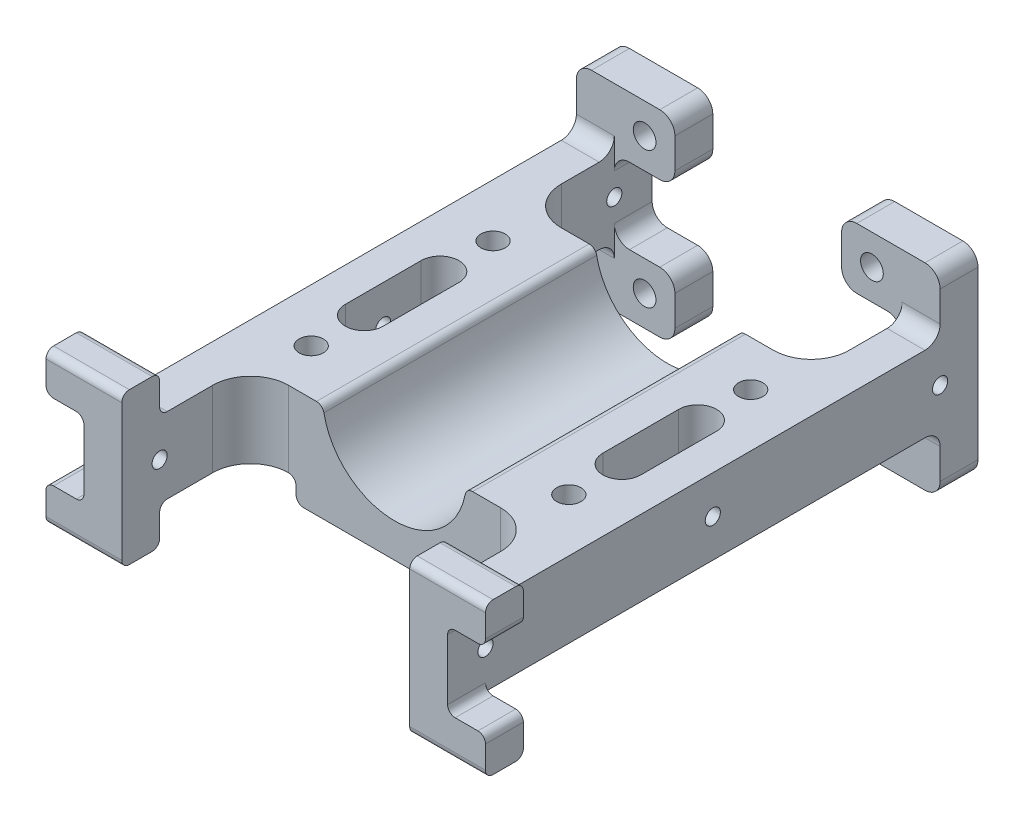
from build123d import *

# Parameters (mm, degrees)
EXTRUDE_1_DEPTH          = 50
CUT_EXTRUDE_1_DEPTH      = 65.195015383
CUT_EXTRUDE_1_DEPTH_BACK = 65.195015383
SKETCH_2_R               = 1.6
SKETCH_2_R_2             = 1.1
CUT_EXTRUDE_4_DEPTH      = 64.914004725
CUT_EXTRUDE_4_DEPTH_BACK = 64.914004725
SKETCH_8_W               = 61
SKETCH_8_H               = 50
SKETCH_8_W_2             = 38
SKETCH_8_H_2             = 36
SKETCH_8_W_3             = 17
SKETCH_8_R               = 1.1
SKETCH_9_W               = 70
SKETCH_9_H               = 10
EXTRUDE_2_DEPTH          = 5
SKETCH_10_R              = 1
CUT_EXTRUDE_5_DEPTH      = 5
SKETCH_11_W              = 5
SKETCH_11_H              = 5
EXTRUDE_3_DEPTH          = 5
FILLET_7_R               = 1
FILLET_8_R               = 1
FILLET_10_R              = 5
MIRROR_START             = 19
MIRROR_1_OUTLINE_R       = 1
MIRROR_1_DEPTH           = 5
MIRROR_START_2           = 24
MIRROR_1_2_OUTLINE_W     = 5
MIRROR_1_2_OUTLINE_H     = 5
MIRROR_1_2_DEPTH         = 4
MIRROR_START_3           = 25
MIRROR_1_3_OUTLINE_W     = 5
MIRROR_1_3_OUTLINE_H     = 5
MIRROR_1_3_DEPTH         = 4
MIRROR_START_4           = 55
MIRROR_1_4_DEPTH         = 5
MIRROR_START_5           = -11
MIRROR_1_5_DEPTH         = 10
MIRROR_START_6           = 28
MIRROR_1_6_DEPTH         = 2
CUT_EXTRUDE_7_DEPTH      = 15
SKETCH_15_R              = 1.5
EXTRUDE_4_DEPTH          = 5
FILLET_11_R              = 2
FILLET_12_R              = 2
SKETCH_16_W              = 8.633126958
SKETCH_16_H              = 25.605085421
SKETCH_16_W_2            = 10.767561134
SKETCH_16_H_2            = 22.237422609
CUT_EXTRUDE_8_DEPTH      = 5


with BuildPart() as part:
    # 草图1 → 凸台-拉伸1 (new body)
    with BuildSketch(Plane.XY):
        with BuildLine():
            Line((-39, -1), (-10.307764064, -1))
            ThreePointArc((-10.307764064, -1), (-9.671555054, -1.22848325), (-9.326072248, -1.80952381))
            ThreePointArc((-9.326072248, -1.80952381), (0, -9.5), (9.326072248, -1.80952381))
            ThreePointArc((9.326072248, -1.80952381), (9.671555054, -1.22848325), (10.307764064, -1))
            Line((10.307764064, -1), (39, -1))
            Line((39, -1), (39, -6))
            Line((39, -6), (22, -6))
            ThreePointArc((22, -6), (21.292893219, -6.292893219), (21, -7))
            Line((21, -7), (21, -11))
            Line((21, -11), (14, -11))
            ThreePointArc((14, -11), (13.292893219, -11.292893219), (13, -12))
            Line((13, -12), (13, -13))
            ThreePointArc((13, -13), (12.707106781, -13.707106781), (12, -14))
            Line((12, -14), (-12, -14))
            ThreePointArc((-12, -14), (-12.707106781, -13.707106781), (-13, -13))
            Line((-13, -13), (-13, -12))
            ThreePointArc((-13, -12), (-13.292893219, -11.292893219), (-14, -11))
            Line((-14, -11), (-21, -11))
            Line((-21, -11), (-21, -7))
            ThreePointArc((-21, -7), (-21.292893219, -6.292893219), (-22, -6))
            Line((-22, -6), (-39, -6))
            Line((-39, -6), (-39, -1))
        make_face()
    extrude(amount=EXTRUDE_1_DEPTH)

    # 草图2 → 切除-拉伸1 (cut, two sides: drawn at the far end of the back side and taken through both)
    with BuildSketch(Plane.XZ.offset(11).offset(-CUT_EXTRUDE_1_DEPTH_BACK)):
        with Locations(Location((-17, 37, 0), (0, 0, 270))):
            Circle(SKETCH_2_R)
        with Locations(Location((17, 37, 0), (0, 0, 270))):
            Circle(SKETCH_2_R)
        with Locations(Location((17, 13, 0), (0, 0, 270))):
            Circle(SKETCH_2_R)
        with Locations(Location((-17, 13, 0), (0, 0, 270))):
            Circle(SKETCH_2_R)
        with Locations(Location((-36, 43, 0), (0, 0, 270))):
            Circle(SKETCH_2_R_2)
        with Locations(Location((-24, 43, 0), (0, 0, 270))):
            Circle(SKETCH_2_R_2)
        with Locations(Location((-24, 35, 0), (0, 0, 270))):
            Circle(SKETCH_2_R_2)
        with Locations(Location((-36, 35, 0), (0, 0, 270))):
            Circle(SKETCH_2_R_2)
        with Locations(Location((36, 35, 0), (0, 0, 180))):
            Circle(SKETCH_2_R_2)
        with Locations(Location((24, 35, 0), (0, 0, 180))):
            Circle(SKETCH_2_R_2)
        with Locations(Location((24, 43, 0), (0, 0, 180))):
            Circle(SKETCH_2_R_2)
        with Locations(Location((36, 43, 0), (0, 0, 180))):
            Circle(SKETCH_2_R_2)
        with Locations(Location((36, 7, 0), (0, 0, 270))):
            Circle(SKETCH_2_R_2)
        with Locations(Location((24, 7, 0), (0, 0, 270))):
            Circle(SKETCH_2_R_2)
        with Locations(Location((24, 15, 0), (0, 0, 270))):
            Circle(SKETCH_2_R_2)
        with Locations(Location((36, 15, 0), (0, 0, 270))):
            Circle(SKETCH_2_R_2)
        with Locations(Location((-36, 15, 0), (0, 0, 180))):
            Circle(SKETCH_2_R_2)
        with Locations(Location((-24, 15, 0), (0, 0, 180))):
            Circle(SKETCH_2_R_2)
        with Locations(Location((-24, 7, 0), (0, 0, 180))):
            Circle(SKETCH_2_R_2)
        with Locations(Location((-36, 7, 0), (0, 0, 180))):
            Circle(SKETCH_2_R_2)
    extrude(amount=CUT_EXTRUDE_1_DEPTH + CUT_EXTRUDE_1_DEPTH_BACK, mode=Mode.SUBTRACT)

    # 草图8 → 切除-拉伸4 (cut, two sides: drawn at the far end of the back side and taken through both)
    # profile 1 of 2: a face of its own
    with BuildSketch(Plane.XZ.offset(6).offset(-CUT_EXTRUDE_4_DEPTH_BACK)):
        with Locations((8.5, 25)):
            Rectangle(SKETCH_8_W, SKETCH_8_H)
        with Locations((0, 25)):
            Rectangle(SKETCH_8_W_2, SKETCH_8_H_2, mode=Mode.SUBTRACT)
    # profile 2 of 2: a face of its own
    with BuildSketch(Plane.XZ.offset(6).offset(-CUT_EXTRUDE_4_DEPTH_BACK)):
        with Locations((-30.5, 25)):
            Rectangle(SKETCH_8_W_3, SKETCH_8_H)
        with Locations((-36, 43)):
            Circle(SKETCH_8_R, mode=Mode.SUBTRACT)
        with Locations((-24, 35)):
            Circle(SKETCH_8_R, mode=Mode.SUBTRACT)
        with Locations((-24, 15)):
            Circle(SKETCH_8_R, mode=Mode.SUBTRACT)
        with Locations((-36, 7)):
            Circle(SKETCH_8_R, mode=Mode.SUBTRACT)
        with Locations((-24, 7)):
            Circle(SKETCH_8_R, mode=Mode.SUBTRACT)
        with Locations((-24, 43)):
            Circle(SKETCH_8_R, mode=Mode.SUBTRACT)
        with Locations((-36, 35)):
            Circle(SKETCH_8_R, mode=Mode.SUBTRACT)
        with Locations((-36, 15)):
            Circle(SKETCH_8_R, mode=Mode.SUBTRACT)
    extrude(amount=CUT_EXTRUDE_4_DEPTH + CUT_EXTRUDE_4_DEPTH_BACK, mode=Mode.SUBTRACT)

    # 草图9 → 凸台-拉伸2 (add)
    with BuildSketch(Plane.ZY.offset(19)):
        with Locations((25, -6)):
            Rectangle(SKETCH_9_W, SKETCH_9_H)
    extrude(amount=EXTRUDE_2_DEPTH)

    # 草图10 → 切除-拉伸5 (cut)
    with BuildSketch(Plane.ZY.offset(24)):
        with Locations((-5, -6)):
            Circle(SKETCH_10_R)
        with Locations((25, -6)):
            Circle(SKETCH_10_R)
        with Locations((55, -6)):
            Circle(SKETCH_10_R)
    extrude(amount=-CUT_EXTRUDE_5_DEPTH, mode=Mode.SUBTRACT)

    # 草图11 → 凸台-拉伸3 (add, symmetric)
    with BuildSketch(Plane.ZY.offset(24)):
        with Locations((-7.5, 1.5)):
            Rectangle(SKETCH_11_W, SKETCH_11_H)
        with Locations((-7.5, -13.5)):
            Rectangle(SKETCH_11_W, SKETCH_11_H)
        with Locations((57.5, -13.5)):
            Rectangle(SKETCH_11_W, SKETCH_11_H)
        with Locations((57.5, 1.5)):
            Rectangle(SKETCH_11_W, SKETCH_11_H)
    extrude(amount=EXTRUDE_3_DEPTH, both=True)

    # 圆角7
    fillet_7_edges = [part.edges().sort_by_distance(p)[0] for p in [
        (-21.5, -11, 55),
        (-24, -16, 60),
        (-24, -16, 55),
        (-21.5, -1, 55),
        (-24, 4, 55),
        (-24, 4, 60),
    ]]
    fillet(fillet_7_edges, radius=FILLET_7_R)

    # 圆角8
    fillet_8_edges = [part.edges().sort_by_distance(p)[0] for p in [
        (-24, -1, 57.5),
        (-24, -11, 57.5),
        (-29, -11, 57.5),
        (-29, -1, 57.5),
    ]]
    fillet(fillet_8_edges, radius=FILLET_8_R)

    # 圆角10
    fillet_10_edges = [part.edges().sort_by_distance(p)[0] for p in [
        (-19, -6, 43),
        (-19, -6, 7),
    ]]
    fillet(fillet_10_edges, radius=FILLET_10_R)

    # 镜向1: read off the stored shape, not the designer's step
    # 镜向1 outline → 镜向1 (add)
    with BuildSketch(Plane.YZ.offset(MIRROR_START)):
        with BuildLine():
            Line((-1, 55), (3, 55))
            ThreePointArc((3, 55), (3.707106781, 55.292893219), (4, 56))
            Line((4, 56), (4, 59))
            ThreePointArc((4, 59), (3.707106781, 59.707106781), (3, 60))
            Line((3, 60), (-15, 60))
            ThreePointArc((-15, 60), (-15.707106781, 59.707106781), (-16, 59))
            Line((-16, 59), (-16, 56))
            ThreePointArc((-16, 56), (-15.707106781, 55.292893219), (-15, 55))
            Line((-15, 55), (-11, 55))
            Line((-11, 55), (-11, -5))
            Line((-11, -5), (-16, -5))
            Line((-16, -5), (-16, -10))
            Line((-16, -10), (4, -10))
            Line((4, -10), (4, -5))
            Line((4, -5), (-1, -5))
            Line((-1, -5), (-1, 55))
        make_face()
        with Locations((-6, 55)):
            Circle(MIRROR_1_OUTLINE_R, mode=Mode.SUBTRACT)
        with Locations((-6, 25)):
            Circle(MIRROR_1_OUTLINE_R, mode=Mode.SUBTRACT)
        with Locations((-6, -5)):
            Circle(MIRROR_1_OUTLINE_R, mode=Mode.SUBTRACT)
    extrude(amount=MIRROR_1_DEPTH)

    # Mirror 1 2 outline → Mirror 1 2 (add)
    with BuildSketch(Plane.YZ.offset(MIRROR_START_2)):
        with BuildLine():
            Line((-1, 60), (-1, 55))
            Line((-1, 55), (3, 55))
            ThreePointArc((3, 55), (3.707106781, 55.292893219), (4, 56))
            Line((4, 56), (4, 59))
            ThreePointArc((4, 59), (3.707106781, 59.707106781), (3, 60))
            Line((3, 60), (-1, 60))
        make_face()
        with BuildLine():
            Line((-11, 55), (-11, 60))
            Line((-11, 60), (-15, 60))
            ThreePointArc((-15, 60), (-15.707106781, 59.707106781), (-16, 59))
            Line((-16, 59), (-16, 56))
            ThreePointArc((-16, 56), (-15.707106781, 55.292893219), (-15, 55))
            Line((-15, 55), (-11, 55))
        make_face()
        with Locations((1.5, -7.5)):
            Rectangle(MIRROR_1_2_OUTLINE_W, MIRROR_1_2_OUTLINE_H)
        with Locations((-13.5, -7.5)):
            Rectangle(MIRROR_1_2_OUTLINE_W, MIRROR_1_2_OUTLINE_H)
    extrude(amount=MIRROR_1_2_DEPTH)

    # Mirror 1 3 outline → Mirror 1 3 (add)
    with BuildSketch(Plane.YZ.offset(MIRROR_START_3)):
        with Locations((1.5, -7.5)):
            Rectangle(MIRROR_1_3_OUTLINE_W, MIRROR_1_3_OUTLINE_H)
        with Locations((-13.5, -7.5)):
            Rectangle(MIRROR_1_3_OUTLINE_W, MIRROR_1_3_OUTLINE_H)
    extrude(amount=MIRROR_1_3_DEPTH)

    # Mirror 1 4 outline → Mirror 1 4 (add)
    with BuildSketch(Plane.XY.offset(MIRROR_START_4)):
        with BuildLine():
            Line((28, -16), (29, -16))
            Line((29, -16), (29, -12))
            ThreePointArc((29, -12), (28.707106781, -11.292893219), (28, -11))
            Line((28, -11), (28, -16))
        make_face()
        with BuildLine():
            Line((24, -11), (25, -11))
            ThreePointArc((25, -11), (24.292893219, -10.707106781), (24, -10))
            Line((24, -10), (24, -11))
        make_face()
        with BuildLine():
            Line((24, -1), (24, -2))
            ThreePointArc((24, -2), (24.292893219, -1.292893219), (25, -1))
            Line((25, -1), (24, -1))
        make_face()
        with BuildLine():
            Line((29, 4), (28, 4))
            Line((28, 4), (28, -1))
            ThreePointArc((28, -1), (28.707106781, -0.707106781), (29, 0))
            Line((29, 0), (29, 4))
        make_face()
    extrude(amount=MIRROR_1_4_DEPTH)

    # Mirror 1 5 outline → Mirror 1 5 (add)
    with BuildSketch(Plane(origin=(0, 0, 0), x_dir=(1, 0, 0), z_dir=(0, 1, 0)).offset(MIRROR_START_5)):
        with BuildLine():
            ThreePointArc((14, -43), (17.535533906, -44.464466094), (19, -48))
            Line((19, -48), (19, -43))
            Line((19, -43), (14, -43))
        make_face()
        with BuildLine():
            Line((19, -7), (19, -2))
            ThreePointArc((19, -2), (17.535533906, -5.535533906), (14, -7))
            Line((14, -7), (19, -7))
        make_face()
    extrude(amount=MIRROR_1_5_DEPTH)

    # Mirror 1 6 outline → Mirror 1 6 (cut)
    with BuildSketch(Plane.YZ.offset(MIRROR_START_6)):
        with BuildLine():
            Line((4, 55), (4, 56))
            ThreePointArc((4, 56), (3.707106781, 55.292893219), (3, 55))
            Line((3, 55), (4, 55))
        make_face()
        with BuildLine():
            Line((4, 60), (3, 60))
            ThreePointArc((3, 60), (3.707106781, 59.707106781), (4, 59))
            Line((4, 59), (4, 60))
        make_face()
        with BuildLine():
            Line((-16, 60), (-16, 59))
            ThreePointArc((-16, 59), (-15.707106781, 59.707106781), (-15, 60))
            Line((-15, 60), (-16, 60))
        make_face()
        with BuildLine():
            Line((-16, 55), (-15, 55))
            ThreePointArc((-15, 55), (-15.707106781, 55.292893219), (-16, 56))
            Line((-16, 56), (-16, 55))
        make_face()
    extrude(amount=MIRROR_1_6_DEPTH, mode=Mode.SUBTRACT)

    # 草图13 → 切除-拉伸7 (cut)
    with BuildSketch(Plane.XZ.offset(11)):
        with BuildLine():
            Line((19.5, 30), (19.5, 20))
            ThreePointArc((19.5, 20), (17, 17.5), (14.5, 20))
            Line((14.5, 20), (14.5, 30))
            ThreePointArc((14.5, 30), (17, 32.5), (19.5, 30))
        make_face()
        with BuildLine():
            Line((-19.5, 30), (-19.5, 20))
            ThreePointArc((-19.5, 20), (-17, 17.5), (-14.5, 20))
            Line((-14.5, 20), (-14.5, 30))
            ThreePointArc((-14.5, 30), (-17, 32.5), (-19.5, 30))
        make_face()
    extrude(amount=-CUT_EXTRUDE_7_DEPTH, mode=Mode.SUBTRACT)

    # 草图15 → 凸台-拉伸4 (add)
    # profile 1 of 4: a face of its own
    with BuildSketch(Plane(origin=(0, 0, -10), x_dir=(-1, 0, 0), z_dir=(0, 0, -1))):
        with BuildLine():
            Line((-24, 4), (-24, 5))
            ThreePointArc((-24, 5), (-23.414213562, 6.414213562), (-22, 7))
            Line((-22, 7), (-13, 7))
            ThreePointArc((-13, 7), (-11.585786438, 6.414213562), (-11, 5))
            Line((-11, 5), (-11, 1))
            ThreePointArc((-11, 1), (-11.585786438, -0.414213562), (-13, -1))
            Line((-13, -1), (-19, -1))
            Line((-19, -1), (-19, 4))
            Line((-19, 4), (-24, 4))
        make_face()
        with Locations(Location((-15, 3, 0), (0, 0, 90))):
            Circle(SKETCH_15_R, mode=Mode.SUBTRACT)
    # profile 2 of 4: a face of its own
    with BuildSketch(Plane(origin=(0, 0, -10), x_dir=(-1, 0, 0), z_dir=(0, 0, -1))):
        with BuildLine():
            Line((13, -1), (19, -1))
            Line((19, -1), (19, 4))
            Line((19, 4), (24, 4))
            Line((24, 4), (24, 5))
            ThreePointArc((24, 5), (23.414213562, 6.414213562), (22, 7))
            Line((22, 7), (13, 7))
            ThreePointArc((13, 7), (11.585786438, 6.414213562), (11, 5))
            Line((11, 5), (11, 1))
            ThreePointArc((11, 1), (11.585786438, -0.414213562), (13, -1))
        make_face()
        with Locations(Location((15, 3, 0), (0, 0, 270))):
            Circle(SKETCH_15_R, mode=Mode.SUBTRACT)
    # profile 3 of 4: a face of its own
    with BuildSketch(Plane(origin=(0, 0, -10), x_dir=(-1, 0, 0), z_dir=(0, 0, -1))):
        with BuildLine():
            Line((24, -16), (24, -17))
            ThreePointArc((24, -17), (23.414213562, -18.414213562), (22, -19))
            Line((22, -19), (13, -19))
            ThreePointArc((13, -19), (11.585786438, -18.414213562), (11, -17))
            Line((11, -17), (11, -13))
            ThreePointArc((11, -13), (11.585786438, -11.585786438), (13, -11))
            Line((13, -11), (19, -11))
            Line((19, -11), (19, -16))
            Line((19, -16), (24, -16))
        make_face()
        with Locations(Location((15, -15, 0), (0, 0, 90))):
            Circle(SKETCH_15_R, mode=Mode.SUBTRACT)
    # profile 4 of 4: a face of its own
    with BuildSketch(Plane(origin=(0, 0, -10), x_dir=(-1, 0, 0), z_dir=(0, 0, -1))):
        with BuildLine():
            Line((-13, -11), (-19, -11))
            Line((-19, -11), (-19, -16))
            Line((-19, -16), (-24, -16))
            Line((-24, -16), (-24, -17))
            ThreePointArc((-24, -17), (-23.414213562, -18.414213562), (-22, -19))
            Line((-22, -19), (-13, -19))
            ThreePointArc((-13, -19), (-11.585786438, -18.414213562), (-11, -17))
            Line((-11, -17), (-11, -13))
            ThreePointArc((-11, -13), (-11.585786438, -11.585786438), (-13, -11))
        make_face()
        with Locations(Location((-15, -15, 0), (0, 0, 270))):
            Circle(SKETCH_15_R, mode=Mode.SUBTRACT)
    extrude(amount=-EXTRUDE_4_DEPTH)

    # 圆角11
    # the kernel refuses this fillet: 2 mm, written as the material it adds along each edge
    with BuildSketch(Plane(origin=(19, -1, -10), x_dir=(0, -1, 0), z_dir=(0, 0, 1)), Plane(origin=(-19, -11, -10), x_dir=(0, 1, 0), z_dir=(0, 0, 1))) as fillet_11_piece_1:
        with BuildLine():
            CenterArc((FILLET_11_R, -FILLET_11_R), FILLET_11_R, 90, 90)
            Line((0, -FILLET_11_R), (0, 0))
            Line((0, 0), (FILLET_11_R, 0))
        make_face()
    extrude(amount=5)
    with BuildSketch(Plane(origin=(-19, -1, -10), x_dir=(0, -1, 0), z_dir=(0, 0, 1)), Plane(origin=(19, -11, -10), x_dir=(0, 1, 0), z_dir=(0, 0, 1))) as fillet_11_piece_2:
        with BuildLine():
            CenterArc((FILLET_11_R, FILLET_11_R), FILLET_11_R, 180, 90)
            Line((0, FILLET_11_R), (0, 0))
            Line((0, 0), (FILLET_11_R, 0))
        make_face()
    extrude(amount=5)

    # 圆角12
    fillet_12_edges = [part.edges().sort_by_distance(p)[0] for p in [
        (-21.5, -1, -5),
        (-21.5, -11, -5),
        (21.5, -1, -5),
        (21.5, -11, -5),
    ]]
    fillet(fillet_12_edges, radius=FILLET_12_R)

    # 草图16 → 切除-拉伸8 (cut)
    with BuildSketch(Plane(origin=(0, 0, -10), x_dir=(-1, 0, 0), z_dir=(0, 0, -1))):
        with Locations((-28.316563479, -8.802542711)):
            Rectangle(SKETCH_16_W, SKETCH_16_H)
        with Locations((29.383780567, -7.118711305)):
            Rectangle(SKETCH_16_W_2, SKETCH_16_H_2)
    extrude(amount=-CUT_EXTRUDE_8_DEPTH, mode=Mode.SUBTRACT)


solid = part.part
